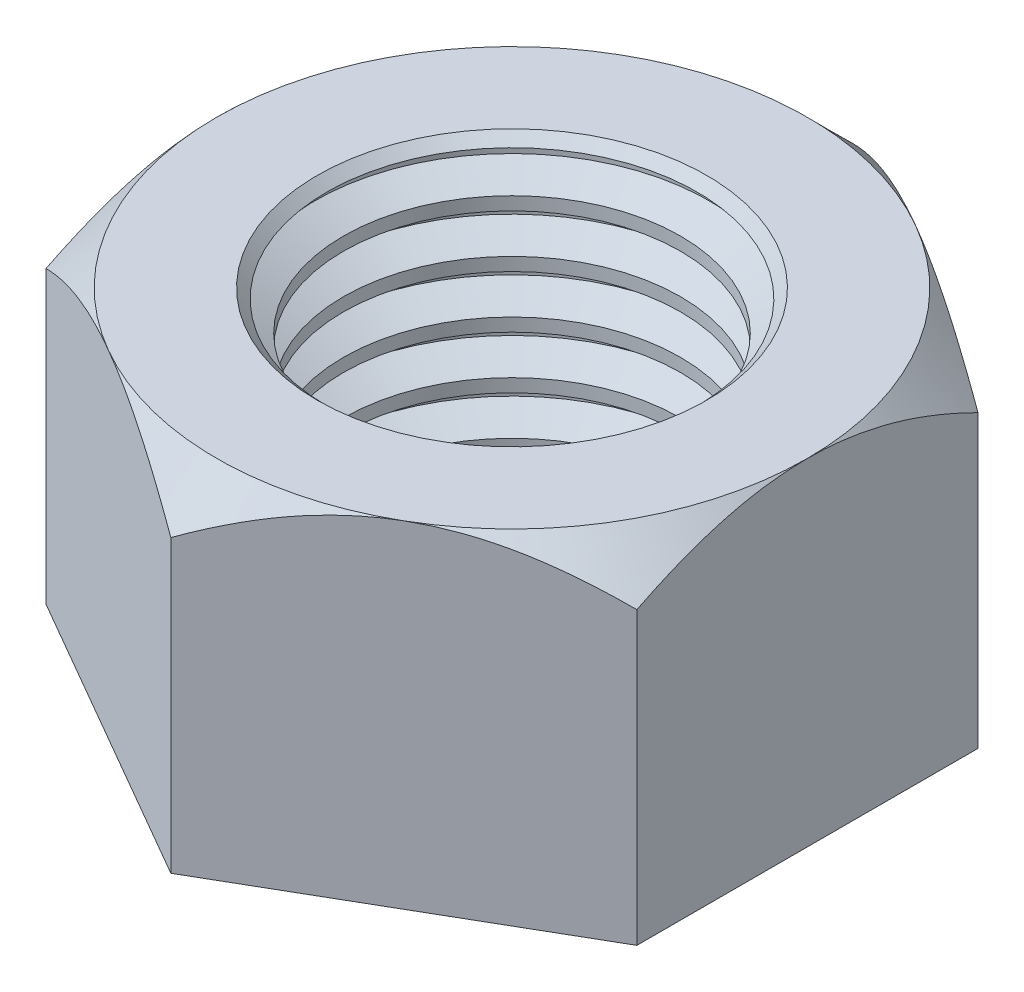
from build123d import *

# Parameters (mm, degrees)
EXTRUDE1_DEPTH  = 16.271875
LPATTERN2_COUNT = 7
LPATTERN2_PITCH = 2.54
CHAMFER1_SIZE   = 1.27
CHAMFER1_SIZE_2 = 0.929704526


with BuildPart() as part:
    # Sketch1 → Extrude1 (new body)
    with BuildSketch(Plane(origin=(0, 0, 0), x_dir=(1, 0, 0), z_dir=(0, 1, 0))):
        Polygon((0, 16.497783942), (-14.2875, 8.248891971), (-14.2875, -8.248891971), (0, -16.497783942), (14.2875, -8.248891971), (14.2875, 8.248891971), align=None)
    extrude(amount=EXTRUDE1_DEPTH)

    # Sketch3 → Cut-Revolve2 (revolve, cut)
    with BuildSketch(Plane(origin=(0, 0, 0), x_dir=(0, 0, -1), z_dir=(1, 0, 0))):
        Polygon((14.2875, 16.271875), (16.497783942, 14.061591058), (16.497783942, 16.271875), align=None)
    revolve(axis=Axis((0, 0.541995889, 0), (0, -1, 0)), mode=Mode.SUBTRACT)

    # Sketch2 → Cut-Revolve1 (revolve, cut)
    with BuildSketch(Plane.XY, mode=Mode.PRIVATE) as cut_revolve1_sk:
        Polygon((0, 16.271875), (8.150184671, 16.271875), (9.525, 15.478125), (9.525, 15.160625), (8.150184671, 14.366875), (8.150184671, 13.731875), (0, 13.731875), align=None)
    cut_revolve1 = revolve(cut_revolve1_sk.sketch.rotate(Axis((0, 1.663578541, 0), (0, -1, 0)), 90), axis=Axis((0, 1.663578541, 0), (0, -1, 0)), mode=Mode.SUBTRACT)

    # LPattern2: Cut-Revolve1 ×7
    with Locations(*[(0, -i * LPATTERN2_PITCH, 0) for i in range(1, LPATTERN2_COUNT)]):
        add(cut_revolve1, mode=Mode.SUBTRACT)

    # Chamfer1
    # the kernel refuses this chamfer: 1.27, 0.929704526 mm, written as the material it takes off along each edge
    with BuildSketch(Plane(origin=(0, 16.271875, 0), x_dir=(0, 0, 1), z_dir=(1, 0, 0))) as chamfer1_piece_1:
        Polygon((8.150184671 + CHAMFER1_SIZE, 0), (8.150184671 + CHAMFER1_SIZE_2 * 0.866025403423, CHAMFER1_SIZE_2 * 0.499999999792), (8.150184671, 0), align=None)
    revolve(axis=Axis((0, 16.271875, 0), (0, -1, 0)), mode=Mode.SUBTRACT)


solid = part.part
